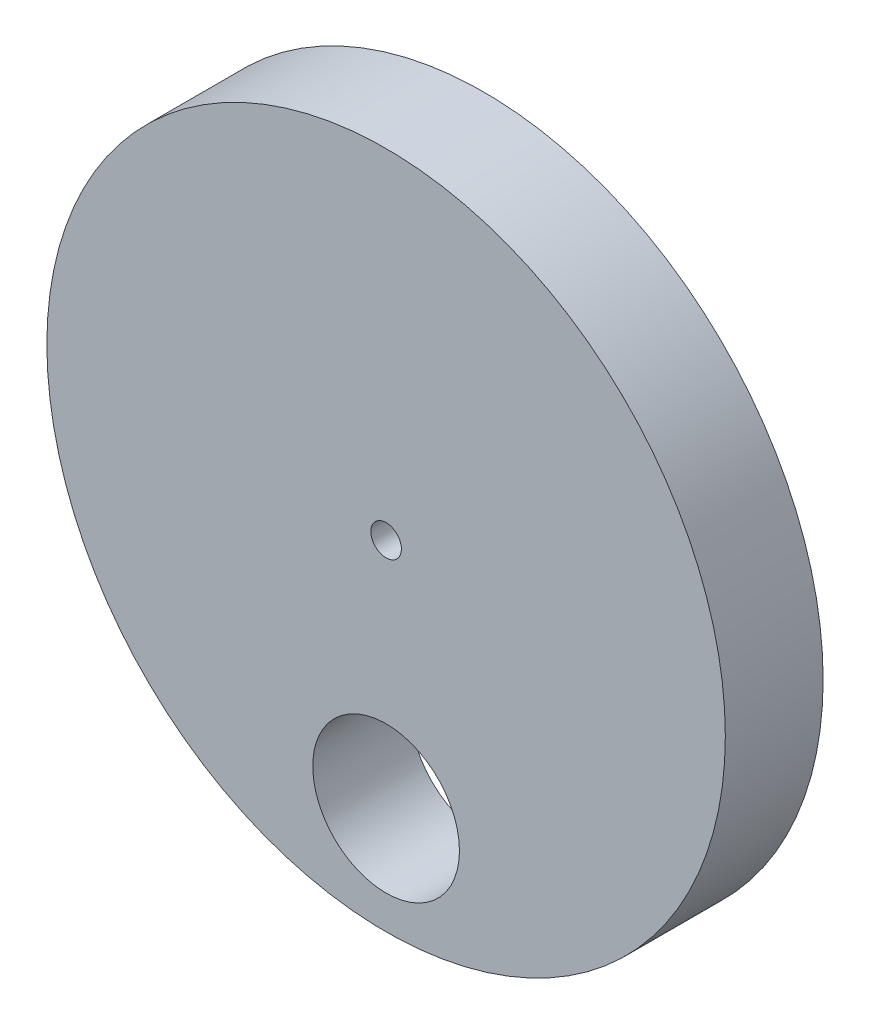
from build123d import *

# Parameters (mm, degrees)
SKETCH1_R           = 55.5
BOSS_EXTRUDE1_DEPTH = 16
SKETCH2_R           = 12
CUT_EXTRUDE1_DEPTH  = 16
SKETCH3_R           = 2.5
CUT_EXTRUDE2_DEPTH  = 16
SHELL2_OUTLINE_R    = 5.6
SHELL2_DEPTH        = 12.9


# Read off the part's stored shape, not the designer's step: Shell2
with BuildPart() as part:
    # Sketch1 → Boss-Extrude1 (new body)
    with BuildSketch(Plane.XY):
        Circle(SKETCH1_R)
    extrude(amount=BOSS_EXTRUDE1_DEPTH)

    # Sketch2 → Cut-Extrude1 (cut)
    with BuildSketch(Plane.XY.offset(16)):
        with Locations((0, -38)):
            Circle(SKETCH2_R)
    extrude(amount=-CUT_EXTRUDE1_DEPTH, mode=Mode.SUBTRACT)

    # Sketch3 → Cut-Extrude2 (cut)
    with BuildSketch(Plane.XY.offset(16)):
        Circle(SKETCH3_R)
    extrude(amount=-CUT_EXTRUDE2_DEPTH, mode=Mode.SUBTRACT)

    # Shell2 outline → Shell2 (cut)
    with BuildSketch(Plane.XY):
        with BuildLine():
            ThreePointArc((5.329299818, -52.128289474), (0, 52.4), (-5.329299818, -52.128289474))
            ThreePointArc((-5.329299818, -52.128289474), (0, -22.9), (5.329299818, -52.128289474))
        make_face()
        Circle(SHELL2_OUTLINE_R, mode=Mode.SUBTRACT)
    extrude(amount=SHELL2_DEPTH, mode=Mode.SUBTRACT)


solid = part.part
